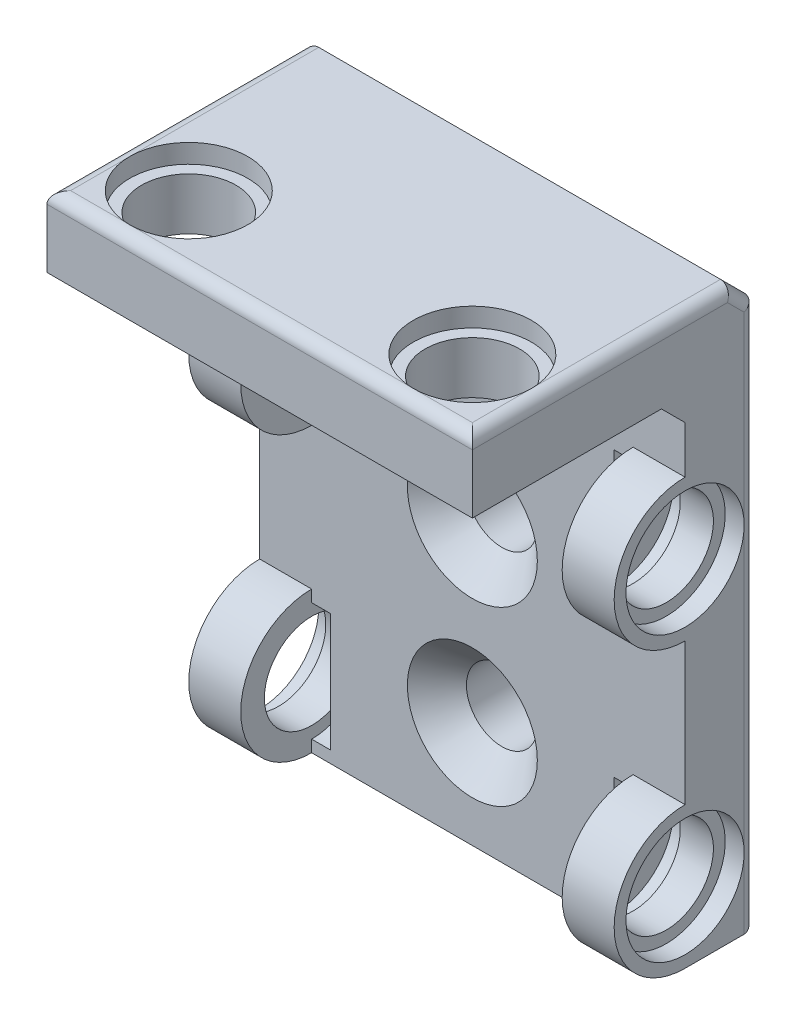
from build123d import *

# Parameters (mm, degrees)
SKETCH1_W                               = 18
SKETCH1_H                               = 30
BOSS_EXTRUDE1_DEPTH                     = 3
SKETCH3_W                               = 18
SKETCH3_H                               = 3
BOSS_EXTRUDE2_DEPTH                     = 9
CBORE_FOR_M5_HEX_HEAD_BOLT1_D           = 4
CBORE_FOR_M5_HEX_HEAD_BOLT1_DEPTH       = 4
CBORE_FOR_M5_HEX_HEAD_BOLT1_CBORE_D     = 5
CBORE_FOR_M5_HEX_HEAD_BOLT1_CBORE_DEPTH = 0.8
CBORE_FOR_M5_HEX_HEAD_BOLT1_TIP         = 1.178090033
CHAMFER1_SIZE                           = 1
SKETCH8_W                               = 18
SKETCH8_H                               = 6
CUT_EXTRUDE1_DEPTH                      = 12
FILLET2_R                               = 0.5
F_3_0MM_DOWEL_HOLE1_D                   = 3
F_3_0MM_DOWEL_HOLE1_DEPTH               = 10
F_3_0MM_DOWEL_HOLE1_TIP                 = 0.901290929


with BuildPart() as part:
    # Sketch1 → Boss-Extrude1 (new body)
    with BuildSketch(Plane.XY):
        Rectangle(SKETCH1_W, SKETCH1_H)
    extrude(amount=BOSS_EXTRUDE1_DEPTH)

    # Sketch2 → Cut-Revolve1 (revolve, cut)
    with BuildSketch(Plane.XY.offset(3)):
        Polygon((6.8, 8.5), (6, 8.5), (6, 6), (9, 6), (9, 8.5), (8.2, 8.5), (8.2, 8), (6.8, 8), align=None)
    cut_revolve1 = revolve(axis=Axis((6.04728637, 6, 3), (1, 0, 0)), mode=Mode.SUBTRACT)

    # Sketch2<3> → Revolve1 (revolve)
    with BuildSketch(Plane.XY.offset(3), mode=Mode.PRIVATE) as revolve1_sk:
        Polygon((6.8, 9), (6.8, 8.5), (6.8, 8), (8.2, 8), (8.2, 8.5), (9, 8.5), (9, 9), align=None)
    revolve1 = revolve(revolve1_sk.sketch.rotate(Axis((6.04728637, 6, 3), (1, 0, 0)), 90), axis=Axis((6.04728637, 6, 3), (1, 0, 0)))

    # Mirror1: Cut-Revolve1, Revolve1 across plane
    add(cut_revolve1.mirror(Plane(origin=(0, 0, 0), x_dir=(0, 0, 1), z_dir=(1, 0, 0))), mode=Mode.SUBTRACT)
    add(revolve1.mirror(Plane(origin=(0, 0, 0), x_dir=(0, 0, 1), z_dir=(1, 0, 0))))

    # Mirror2: Cut-Revolve1, Revolve1 across plane
    add(cut_revolve1.mirror(Plane.ZX), mode=Mode.SUBTRACT)
    add(revolve1.mirror(Plane.ZX))

    # Mirror2 copy 1 sketch → Mirror2 copy 1 (revolve, cut)
    with BuildSketch(Plane(origin=(0, 0, 3), x_dir=(-1, 0, 0), z_dir=(0, 0, 1))):
        Polygon((6.8, 8.5), (6, 8.5), (6, 6), (9, 6), (9, 8.5), (8.2, 8.5), (8.2, 8), (6.8, 8), align=None)
    revolve(axis=Axis((-6.04728637, -6, 3), (-1, 0, 0)), mode=Mode.SUBTRACT)

    # Mirror2 copy 2 sketch → Mirror2 copy 2 (revolve)
    with BuildSketch(Plane(origin=(0, 0, 3), x_dir=(-1, 0, 0), z_dir=(0, 0, 1))):
        Polygon((6.8, 9), (6.8, 8.5), (6.8, 8), (8.2, 8), (8.2, 8.5), (9, 8.5), (9, 9), align=None)
    revolve(axis=Axis((-6.04728637, -6, 3), (-1, 0, 0)))

    # Sketch3 → Boss-Extrude2 (add)
    with BuildSketch(Plane.XY.offset(3)):
        with Locations((0, 13.5)):
            Rectangle(SKETCH3_W, SKETCH3_H)
    extrude(amount=BOSS_EXTRUDE2_DEPTH)

    # CBORE for M5 Hex Head Bolt1
    with Locations(Plane(origin=(0, 15, 0), x_dir=(1, 0, 0), z_dir=(0, 1, 0))):
        with Locations((-6, -9), (6, -9)):
            CounterBoreHole(CBORE_FOR_M5_HEX_HEAD_BOLT1_D / 2, CBORE_FOR_M5_HEX_HEAD_BOLT1_CBORE_D / 2, CBORE_FOR_M5_HEX_HEAD_BOLT1_CBORE_DEPTH, depth=CBORE_FOR_M5_HEX_HEAD_BOLT1_DEPTH)
            with Locations((0, 0, -(CBORE_FOR_M5_HEX_HEAD_BOLT1_DEPTH + CBORE_FOR_M5_HEX_HEAD_BOLT1_TIP / 2))):  # 119° drill point
                Cone(0, CBORE_FOR_M5_HEX_HEAD_BOLT1_D / 2, CBORE_FOR_M5_HEX_HEAD_BOLT1_TIP, mode=Mode.SUBTRACT)

    # Chamfer1
    chamfer1_edges = [part.edges().sort_by_distance(p)[0] for p in [
        (0, 12, 3),
        (0, 15, 0),
    ]]
    chamfer(chamfer1_edges, length=CHAMFER1_SIZE)

    # Sketch8 → Cut-Extrude1 (cut)
    with BuildSketch(Plane(origin=(0, 0, 0), x_dir=(-1, 0, 0), z_dir=(0, 0, -1))):
        with Locations((0, -12)):
            Rectangle(SKETCH8_W, SKETCH8_H)
    extrude(amount=-CUT_EXTRUDE1_DEPTH, mode=Mode.SUBTRACT)

    # Fillet2
    # the kernel refuses this fillet: 0.5 mm, written as the material it takes off along each edge
    with BuildSketch(Plane(origin=(-10.25, 15, 12), x_dir=(0, 0, -1), z_dir=(1, 0, 0))) as fillet2_piece_1:
        with BuildLine():
            CenterArc((FILLET2_R, -FILLET2_R), FILLET2_R, 90, 90)
            Line((0, -FILLET2_R), (0, 0))
            Line((0, 0), (FILLET2_R, 0))
        make_face()
    extrude(amount=20.5, mode=Mode.SUBTRACT)
    with BuildSketch(Plane(origin=(-9, 6.000000014, 0), x_dir=(1, 0, 0), z_dir=(0, -1, 0))) as fillet2_piece_2:
        with BuildLine():
            CenterArc((FILLET2_R, FILLET2_R), FILLET2_R, 180, 90)
            Line((0, FILLET2_R), (0, 0))
            Line((0, 0), (FILLET2_R, 0))
        make_face()
    extrude(amount=12.000000014, mode=Mode.SUBTRACT)
    with BuildSketch(Plane(origin=(-9, 15.883883476, 1.883883476), x_dir=(0, -0.7071067811865476, 0.7071067811865476), z_dir=(0, -0.7071067811865476, -0.7071067811865476)), Plane(origin=(9, 15.883883476, 1.883883476), x_dir=(-1, 0, 0), z_dir=(0, -0.7071067811865476, -0.7071067811865476))) as fillet2_piece_3:
        with BuildLine():
            CenterArc((FILLET2_R, -FILLET2_R), FILLET2_R, 90, 90)
            Line((0, -FILLET2_R), (0, 0))
            Line((0, 0), (FILLET2_R, 0))
        make_face()
    extrude(amount=3.914213562, mode=Mode.SUBTRACT)
    with BuildSketch(Plane(origin=(9, -6.000000014, 0), x_dir=(-1, 0, 0), z_dir=(0, 1, 0))) as fillet2_piece_4:
        with BuildLine():
            CenterArc((FILLET2_R, FILLET2_R), FILLET2_R, 180, 90)
            Line((0, FILLET2_R), (0, 0))
            Line((0, 0), (FILLET2_R, 0))
        make_face()
    extrude(amount=12.000000015, mode=Mode.SUBTRACT)
    with BuildSketch(Plane(origin=(10.25, -9, 0), x_dir=(0, 0, 1), z_dir=(-1, 0, 0))) as fillet2_piece_5:
        with BuildLine():
            CenterArc((FILLET2_R, FILLET2_R), FILLET2_R, 180, 90)
            Line((0, FILLET2_R), (0, 0))
            Line((0, 0), (FILLET2_R, 0))
        make_face()
    extrude(amount=20.5, mode=Mode.SUBTRACT)
    with BuildSketch(Plane(origin=(9, 15, 13.25), x_dir=(-1, 0, 0), z_dir=(0, 0, -1)), Plane(origin=(-9, 15, -0.25), x_dir=(1, 0, 0), z_dir=(0, 0, 1))) as fillet2_piece_6:
        with BuildLine():
            CenterArc((FILLET2_R, -FILLET2_R), FILLET2_R, 90, 90)
            Line((0, -FILLET2_R), (0, 0))
            Line((0, 0), (FILLET2_R, 0))
        make_face()
    extrude(amount=13.5, mode=Mode.SUBTRACT)
    with BuildSketch(Plane(origin=(9, -10.25, 0), x_dir=(-1, 0, 0), z_dir=(0, 1, 0))) as fillet2_piece_7:
        with BuildLine():
            CenterArc((FILLET2_R, FILLET2_R), FILLET2_R, 180, 90)
            Line((0, FILLET2_R), (0, 0))
            Line((0, 0), (FILLET2_R, 0))
        make_face()
    extrude(amount=4.249999986, mode=Mode.SUBTRACT)
    with BuildSketch(Plane(origin=(9, 6, 0), x_dir=(-1, 0, 0), z_dir=(0, 1, 0))) as fillet2_piece_8:
        with BuildLine():
            CenterArc((FILLET2_R, FILLET2_R), FILLET2_R, 180, 90)
            Line((0, FILLET2_R), (0, 0))
            Line((0, 0), (FILLET2_R, 0))
        make_face()
    extrude(amount=9.25, mode=Mode.SUBTRACT)
    with BuildSketch(Plane(origin=(-9, 15.25, 0), x_dir=(1, 0, 0), z_dir=(0, -1, 0))) as fillet2_piece_9:
        with BuildLine():
            CenterArc((FILLET2_R, FILLET2_R), FILLET2_R, 180, 90)
            Line((0, FILLET2_R), (0, 0))
            Line((0, 0), (FILLET2_R, 0))
        make_face()
    extrude(amount=9.249999986, mode=Mode.SUBTRACT)
    with BuildSketch(Plane(origin=(-9, -6, 0), x_dir=(1, 0, 0), z_dir=(0, -1, 0))) as fillet2_piece_10:
        with BuildLine():
            CenterArc((FILLET2_R, FILLET2_R), FILLET2_R, 180, 90)
            Line((0, FILLET2_R), (0, 0))
            Line((0, 0), (FILLET2_R, 0))
        make_face()
    extrude(amount=4.25, mode=Mode.SUBTRACT)

    # Ø3.0mm Dowel Hole1
    with Locations(Plane(origin=(0, 0, 0), x_dir=(-1, 0, 0), z_dir=(0, 0, -1))):
        with Locations((0, -4.5), (0, 2.8)):
            Hole(F_3_0MM_DOWEL_HOLE1_D / 2, depth=F_3_0MM_DOWEL_HOLE1_DEPTH)
            with Locations((0, 0, -(F_3_0MM_DOWEL_HOLE1_DEPTH + F_3_0MM_DOWEL_HOLE1_TIP / 2))):  # 118° drill point
                Cone(0, F_3_0MM_DOWEL_HOLE1_D / 2, F_3_0MM_DOWEL_HOLE1_TIP, mode=Mode.SUBTRACT)

    # Cut-Extrude2 cone 1 section (through the dimple's axis) → Cut-Extrude2 (revolve, cut)
    with BuildSketch(Plane(origin=(0, 2.8, 3), x_dir=(0, -1, 0), z_dir=(1, 0, 0))):
        Polygon((0, 0), (2.75, 0), (0, 2.75), align=None)
    revolve(axis=Axis((0, 2.8, 3), (0, 0, -1)), mode=Mode.SUBTRACT)

    # Cut-Extrude2 cone 2 section (through the dimple's axis) → Cut-Extrude2 cone 2 (revolve, cut)
    with BuildSketch(Plane(origin=(0, -4.5, 3), x_dir=(0, -1, 0), z_dir=(1, 0, 0))):
        Polygon((0, 0), (2.75, 0), (0, 2.75), align=None)
    revolve(axis=Axis((0, -4.5, 3), (0, 0, -1)), mode=Mode.SUBTRACT)


solid = part.part
